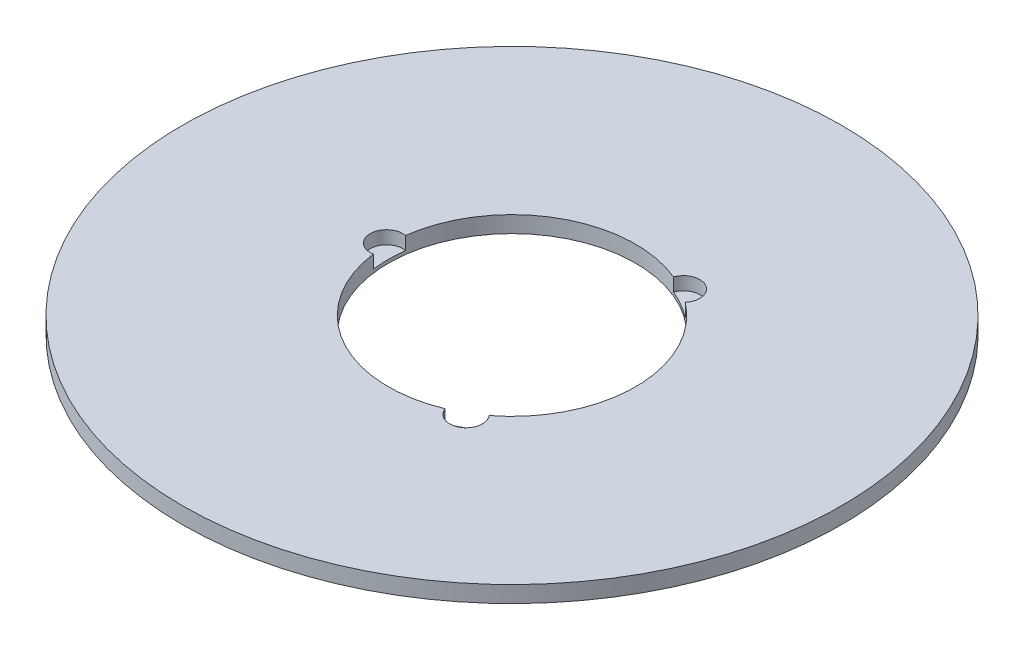
from build123d import *

# Parameters (mm, degrees)
SKETCH1_R           = 80
BOSS_EXTRUDE1_DEPTH = 4
SKETCH2_R           = 30
CUT_EXTRUDE1_DEPTH  = 114.207773585
SKETCH3_R           = 3.968983721
CUT_EXTRUDE2_DEPTH  = 3.183682304
CIRPATTERN1_COUNT   = 3


with BuildPart() as part:
    # Sketch1 → Boss-Extrude1 (new body)
    with BuildSketch(Plane(origin=(0, 0, 0), x_dir=(1, 0, 0), z_dir=(0, 1, 0))):
        Circle(SKETCH1_R)
    extrude(amount=BOSS_EXTRUDE1_DEPTH)

    # Sketch2 → Cut-Extrude1 (cut, through all)
    with BuildSketch(Plane(origin=(0, 0, 0), x_dir=(1, 0, 0), z_dir=(0, 1, 0))):
        Circle(SKETCH2_R)
    extrude(amount=CUT_EXTRUDE1_DEPTH, mode=Mode.SUBTRACT)

    # Sketch3 → Cut-Extrude2 (cut)
    with BuildSketch(Plane(origin=(0, 4, 0), x_dir=(1, 0, 0), z_dir=(0, 1, 0))):
        with Locations((-30.458626443, 0)):
            Circle(SKETCH3_R)
    cut_extrude2 = extrude(amount=-CUT_EXTRUDE2_DEPTH, mode=Mode.SUBTRACT)

    # CirPattern1: Cut-Extrude2 ×3 about axis
    cirpattern1_axis = Axis((0, 0, 0), (0, 1, 0))
    for i in range(1, CIRPATTERN1_COUNT):
        add(cut_extrude2.rotate(cirpattern1_axis, i * 360 / CIRPATTERN1_COUNT), mode=Mode.SUBTRACT)


solid = part.part
